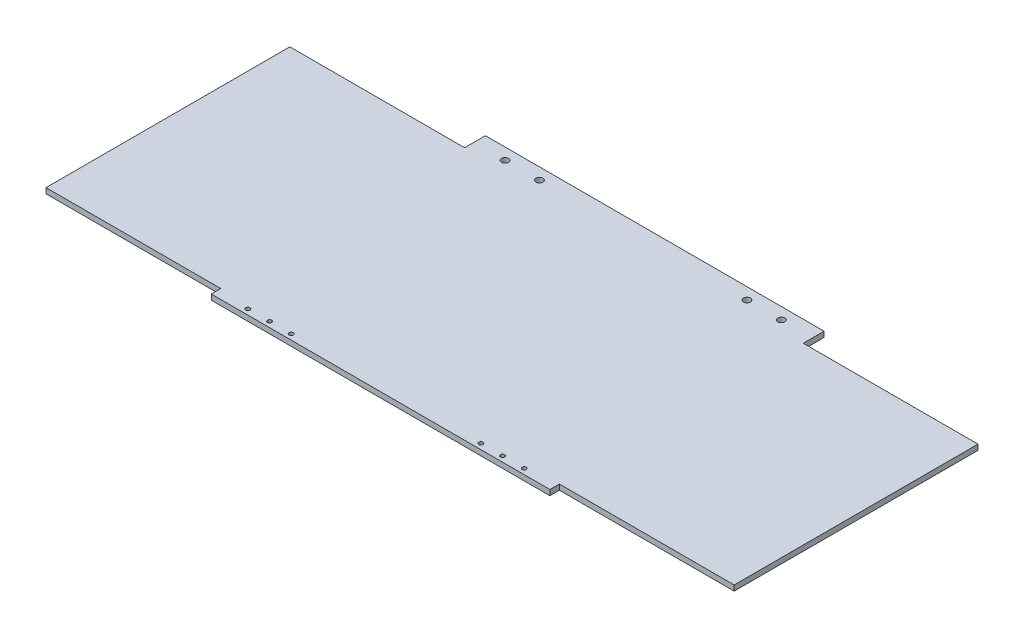
from build123d import *

# Parameters (mm, degrees)
SKETCH1_R           = 2.564
SKETCH1_R_2         = 1.54
BOSS_EXTRUDE1_DEPTH = 4


with BuildPart() as part:
    # Sketch1 → Boss-Extrude1 (new body)
    with BuildSketch(Plane(origin=(0, 0, 0), x_dir=(1, 0, 0), z_dir=(0, 1, 0))):
        Polygon((129, 0), (129, -7), (379, -7), (379, 0), (508, 0), (508, 180), (379, 180), (379, 195.398), (129, 195.398), (129, 180), (0, 180), (0, 0), align=None)
        with Locations((152, 186.858)):
            Circle(SKETCH1_R, mode=Mode.SUBTRACT)
        with Locations((177.4, 186.858)):
            Circle(SKETCH1_R, mode=Mode.SUBTRACT)
        with Locations((152, -3)):
            Circle(SKETCH1_R_2, mode=Mode.SUBTRACT)
        with Locations((184, -3)):
            Circle(SKETCH1_R_2, mode=Mode.SUBTRACT)
        with Locations((330.6, 186.858)):
            Circle(SKETCH1_R, mode=Mode.SUBTRACT)
        with Locations((356, 186.858)):
            Circle(SKETCH1_R, mode=Mode.SUBTRACT)
        with Locations((168, -3)):
            Circle(SKETCH1_R_2, mode=Mode.SUBTRACT)
        with Locations((324, -3)):
            Circle(SKETCH1_R_2, mode=Mode.SUBTRACT)
        with Locations((340, -3)):
            Circle(SKETCH1_R_2, mode=Mode.SUBTRACT)
        with Locations((356, -3)):
            Circle(SKETCH1_R_2, mode=Mode.SUBTRACT)
    extrude(amount=BOSS_EXTRUDE1_DEPTH)


solid = part.part
